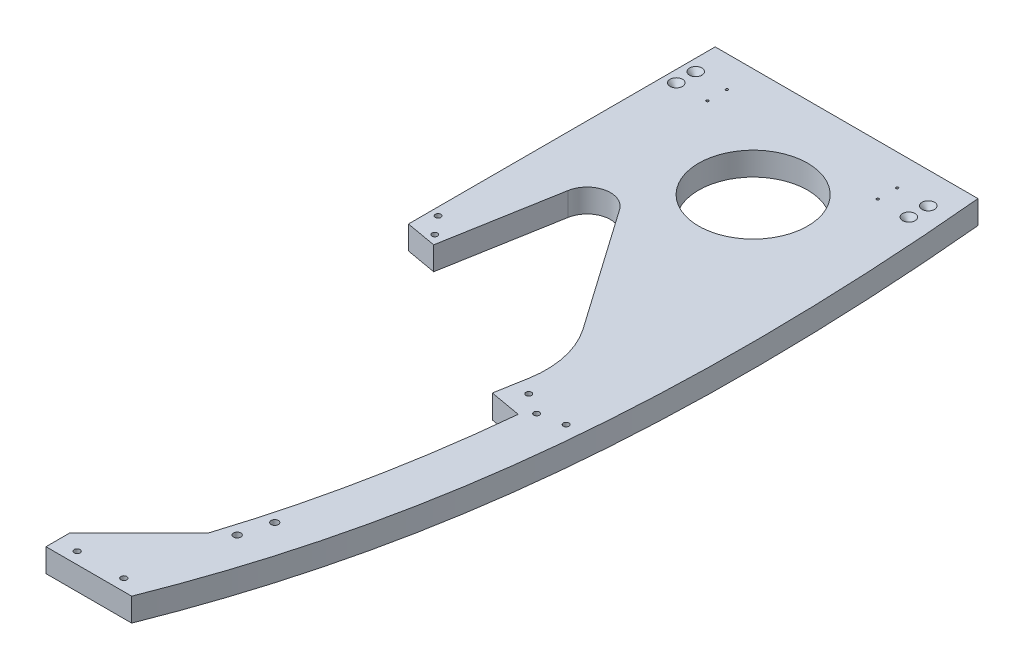
from build123d import *

# Parameters (mm, degrees)
STOCK_LEFT_START                     = 6431.28
STOCK_LEFT_CONSOLE_1_OUTLINE_R       = 2.413
STOCK_LEFT_CONSOLE_1_OUTLINE_R_2     = 2.286
STOCK_LEFT_CONSOLE_1_OUTLINE_R_3     = 44.45
STOCK_LEFT_CONSOLE_1_DEPTH           = 19.05
F_5_64_0_07813_DIAMETER_HOLE1_D      = 1.984502
F_5_64_0_07813_DIAMETER_HOLE1_DEPTH  = 38.1
F_5_64_0_07813_DIAMETER_HOLE1_TIP    = 0.59620455
BOSS_EXTRUDE1_START                  = -19.05
BOSS_EXTRUDE1_OUTLINE_R              = 2.286
BOSS_EXTRUDE1_DEPTH                  = 19.05
HOLE1_D                              = 1.98374
HOLE1_DEPTH                          = 19.05
HOLE1_CSINK_D                        = 10.16
HOLE1_CSINK_ANGLE                    = 82
HOLE1_TIP                            = 0.595975622
HOLE2_D                              = 1.98374
HOLE2_DEPTH                          = 19.05
HOLE2_CSINK_D                        = 10.16
HOLE2_CSINK_ANGLE                    = 82
HOLE2_TIP                            = 0.595975622
F_15_64_0_23438_DIAMETER_HOLE1_D     = 5.953252
F_15_64_0_23438_DIAMETER_HOLE1_DEPTH = 12.7
F_15_64_0_23438_DIAMETER_HOLE1_TIP   = 1.788537341
F_15_64_0_23438_DIAMETER_HOLE2_D     = 5.953252


# Read off the part's stored shape, not the designer's step: Stock-Left Console-1, Boss-Extrude1
with BuildPart() as part:
    # Stock-Left Console-1 outline → Stock-Left Console-1 (new body)
    with BuildSketch(Plane(origin=(0, 0, 0), x_dir=(1, 0, 0), z_dir=(0, 1, 0)).offset(STOCK_LEFT_START)):
        with BuildLine():
            Line((353.196306153, -3309.424544766), (423.069705531, -3309.424544766))
            add(Edge.make_bspline(
                [(423.069705531, -3309.424544766), (434.676301998, -3280.094685679), (456.53807666, -3217.87007969), (480.802657469, -3123.46791246), (497.152531183, -2998.37635173), (499.121078474, -2872.443438768), (495.162225728, -2779.542988889), (490.685406778, -2719.533883381), (487.819917683, -2688.261335695), (487.371826131, -2683.51)],
                knots=[0.023029316, 0.023029316, 0.023029316, 0.023029316, 0.023029316, 0.023029316, 0.2, 0.4, 0.6, 0.8, 0.836087244, 0.836087244, 0.836087244, 0.836087244, 0.836087244, 0.836087244], degree=5))
            Line((487.371826131, -2683.51), (273.05, -2683.51))
            Line((273.05, -2683.51), (273.05, -2933.697739453))
            Line((273.05, -2933.697739453), (298.063657039, -2938.111010521))
            Line((298.063657039, -2938.111010521), (314.509168719, -2844.900694856))
            ThreePointArc((314.509168719, -2844.900694856), (329.148175506, -2829.611779536), (348.875396808, -2837.285643691))
            Line((348.875396808, -2837.285643691), (418.46673344, -2936.694424797))
            ThreePointArc((418.46673344, -2936.694424797), (430.437407412, -2963.905621352), (431.085142982, -2993.626433789))
            Line((431.085142982, -2993.626433789), (426.637650168, -3018.849418929))
            Line((426.637650168, -3018.849418929), (452.243736667, -3023.367214968))
            add(Edge.make_bspline(
                [(452.243736667, -3023.367214968), (451.641719679, -3029.407501569), (450.993305037, -3035.457523806), (450.296260246, -3041.516036426), (444.731873581, -3089.880083152), (436.040032503, -3138.779699606), (422.995639906, -3188.064574694), (418.989999077, -3203.198856068), (414.570327772, -3218.371482466), (409.713935455, -3233.590617751)],
                knots=[-0.370150085, -0.370150085, -0.370150085, -0.370150085, -0.346597766, -0.346597766, -0.346597766, -0.158583722, -0.158583722, -0.158583722, -0.10084882, -0.10084882, -0.10084882, -0.10084882], degree=3))
            Line((409.713935455, -3233.590617751), (353.157982261, -3290.374583315))
            Line((353.157982261, -3290.374583315), (353.196306153, -3309.424544766))
        make_face()
        with Locations((369.053241877, -3299.899544705)):
            Circle(STOCK_LEFT_CONSOLE_1_OUTLINE_R, mode=Mode.SUBTRACT)
        with Locations((407.153344675, -3299.899544705)):
            Circle(STOCK_LEFT_CONSOLE_1_OUTLINE_R, mode=Mode.SUBTRACT)
        with Locations((442.048499768, -3004.586532902)):
            Circle(STOCK_LEFT_CONSOLE_1_OUTLINE_R_2, mode=Mode.SUBTRACT)
        with Locations((459.21263657, -3015.368580683)):
            Circle(STOCK_LEFT_CONSOLE_1_OUTLINE_R_2, mode=Mode.SUBTRACT)
        with Locations((479.030214676, -3011.111381543)):
            Circle(STOCK_LEFT_CONSOLE_1_OUTLINE_R_2, mode=Mode.SUBTRACT)
        with Locations((291.299291638, -2930.46946591)):
            Circle(STOCK_LEFT_CONSOLE_1_OUTLINE_R_2, mode=Mode.SUBTRACT)
        with Locations((279.4, -2915.847898591)):
            Circle(STOCK_LEFT_CONSOLE_1_OUTLINE_R_2, mode=Mode.SUBTRACT)
        with Locations((292.1, -2727.960000043)):
            Circle(STOCK_LEFT_CONSOLE_1_OUTLINE_R_2, mode=Mode.SUBTRACT)
        with Locations((292.1, -2702.559999968)):
            Circle(STOCK_LEFT_CONSOLE_1_OUTLINE_R_2, mode=Mode.SUBTRACT)
        with Locations((317.5, -2702.559999968)):
            Circle(STOCK_LEFT_CONSOLE_1_OUTLINE_R_2, mode=Mode.SUBTRACT)
        with Locations((392.883884122, -2772.410060986)):
            Circle(STOCK_LEFT_CONSOLE_1_OUTLINE_R_3, mode=Mode.SUBTRACT)
        with Locations((450.85, -2727.960000048)):
            Circle(STOCK_LEFT_CONSOLE_1_OUTLINE_R_2, mode=Mode.SUBTRACT)
        with Locations((450.85, -2702.560000048)):
            Circle(STOCK_LEFT_CONSOLE_1_OUTLINE_R_2, mode=Mode.SUBTRACT)
    extrude(amount=STOCK_LEFT_CONSOLE_1_DEPTH)

    # 5/64 (0.07813) Diameter Hole1
    with Locations(Plane(origin=(0, 0, 2664.46), x_dir=(-1, 0, 0), z_dir=(0, 0, -1))):
        with Locations((-481.589248274, 6993.254992531), (-386.339248274, 6993.254992531), (-291.089248274, 6993.254992531), (-295.274999999, 6965.135938475), (-295.274999999, 6812.735938475), (-295.274999999, 6660.335938474), (-285.166362357, 6631.468843414), (-475.477307398, 6631.468752771), (-485.002307398, 6660.335938474), (-485.002307398, 6812.735938474), (-485.002307398, 6965.135938474), (-478.365617646, 6611.6708), (-287.865617646, 6611.6708), (-307.975, 6564.3379), (-307.975, 6488.1379), (-284.960913066, 6440.805), (-380.210913066, 6440.805), (-475.460913066, 6440.805), (-446.831312422, 6488.1379), (-446.831312422, 6564.3379), (-472.231312422, 6396.355), (-472.231312422, 6320.155), (-472.653156211, 6275.705000839), (-377.403156211, 6275.705000839), (-282.153156211, 6275.705000839), (-282.575, 6320.155), (-282.575, 6396.355), (-435.598646187, 6221.729999816), (-435.598646187, 6145.529999816), (-450.592518112, 6091.554999951), (-460.998646187, 6091.555478285), (-460.998646187, 6056.629999944), (-460.998646187, 5980.429999944), (-460.998646187, 5945.505000042), (-282.153156211, 5945.505000042), (-368.611823093, 5945.505000042)):
            Hole(F_5_64_0_07813_DIAMETER_HOLE1_D / 2, depth=F_5_64_0_07813_DIAMETER_HOLE1_DEPTH)
            with Locations((0, 0, -(F_5_64_0_07813_DIAMETER_HOLE1_DEPTH + F_5_64_0_07813_DIAMETER_HOLE1_TIP / 2))):  # 118° drill point
                Cone(0, F_5_64_0_07813_DIAMETER_HOLE1_D / 2, F_5_64_0_07813_DIAMETER_HOLE1_TIP, mode=Mode.SUBTRACT)

    # Boss-Extrude1 outline → Boss-Extrude1 (add)
    with BuildSketch(Plane(origin=(0, 6450.33, 0), x_dir=(1, 0, 0), z_dir=(0, 1, 0)).offset(BOSS_EXTRUDE1_START)):
        with Locations((292.1, -2727.960000043)):
            Circle(BOSS_EXTRUDE1_OUTLINE_R)
        with Locations((292.1, -2702.559999968)):
            Circle(BOSS_EXTRUDE1_OUTLINE_R)
        with Locations((317.5, -2702.559999968)):
            Circle(BOSS_EXTRUDE1_OUTLINE_R)
        with Locations((450.85, -2727.960000048)):
            Circle(BOSS_EXTRUDE1_OUTLINE_R)
        with Locations((450.85, -2702.560000048)):
            Circle(BOSS_EXTRUDE1_OUTLINE_R)
    extrude(amount=BOSS_EXTRUDE1_DEPTH)

    # Hole1
    with Locations(Plane(origin=(0, 6450.33, 0), x_dir=(1, 0, 0), z_dir=(0, 1, 0))):
        with Locations((282.575, -2708.910106723), (282.575, -2724.785106722), (472.231312422, -2724.785106723), (472.231312422, -2708.910106723)):
            CounterSinkHole(HOLE1_D / 2, HOLE1_CSINK_D / 2, depth=HOLE1_DEPTH, counter_sink_angle=HOLE1_CSINK_ANGLE)
            with Locations((0, 0, -(HOLE1_DEPTH + HOLE1_TIP / 2))):  # 118° drill point
                Cone(0, HOLE1_D / 2, HOLE1_TIP, mode=Mode.SUBTRACT)

    # Hole2
    with Locations(Plane(origin=(0, 6431.28, 0), x_dir=(-1, 0, 0), z_dir=(0, -1, 0))):
        with Locations((-307.975, -2724.785), (-307.975, -2708.91), (-446.831312422, -2724.785), (-446.831312422, -2708.91)):
            CounterSinkHole(HOLE2_D / 2, HOLE2_CSINK_D / 2, depth=HOLE2_DEPTH, counter_sink_angle=HOLE2_CSINK_ANGLE)
            with Locations((0, 0, -(HOLE2_DEPTH + HOLE2_TIP / 2))):  # 118° drill point
                Cone(0, HOLE2_D / 2, HOLE2_TIP, mode=Mode.SUBTRACT)

    # 15/64 (0.23438) Diameter Hole1
    with Locations(Plane.ZY.offset(-273.05)):
        with Locations((2746.056934863, 6440.805), (2871.15080459, 6440.805)):
            Hole(F_15_64_0_23438_DIAMETER_HOLE1_D / 2, depth=F_15_64_0_23438_DIAMETER_HOLE1_DEPTH)
            with Locations((0, 0, -(F_15_64_0_23438_DIAMETER_HOLE1_DEPTH + F_15_64_0_23438_DIAMETER_HOLE1_TIP / 2))):  # 118° drill point
                Cone(0, F_15_64_0_23438_DIAMETER_HOLE1_D / 2, F_15_64_0_23438_DIAMETER_HOLE1_TIP, mode=Mode.SUBTRACT)

    # 15/64 (0.23438) Diameter Hole2 (through all)
    with Locations(Plane(origin=(0, 6431.28, 0), x_dir=(-1, 0, 0), z_dir=(0, -1, 0))):
        with Locations((-422.906806841, -3223.193590462), (-429.375462934, -3199.052237264)):
            Hole(F_15_64_0_23438_DIAMETER_HOLE2_D / 2)


solid = part.part
